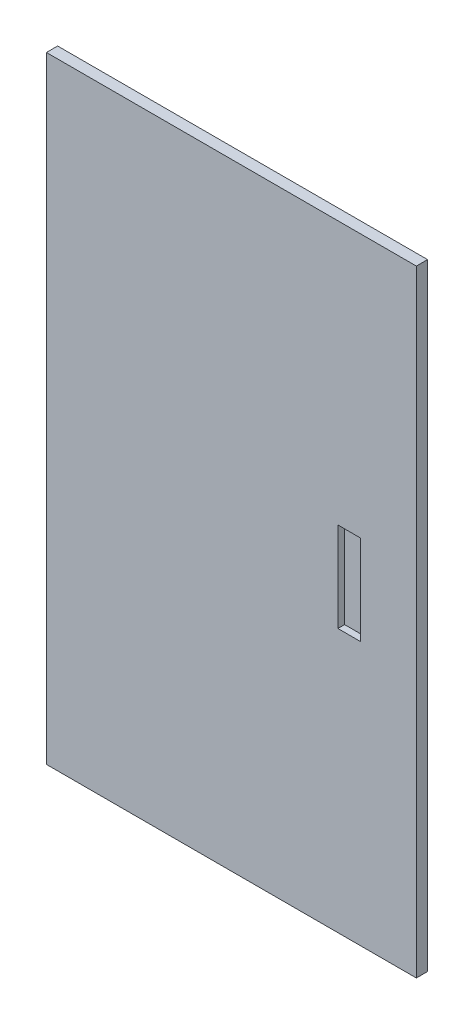
from build123d import *

# Parameters (mm, degrees)
SKETCH1_W           = 419.1
SKETCH1_H           = 698.5
BOSS_EXTRUDE1_DEPTH = 12.7
SKETCH2_W           = 38.1
SKETCH2_H           = 101.6
CUT_EXTRUDE1_DEPTH  = 7.62
SKETCH3_W           = 12.7
SKETCH3_H           = 101.6
BOSS_EXTRUDE2_DEPTH = 2.54
FILLET1_R           = 2.54


with BuildPart() as part:
    # Sketch1 → Boss-Extrude1 (new body)
    with BuildSketch(Plane.XY):
        Rectangle(SKETCH1_W, SKETCH1_H)
    extrude(amount=BOSS_EXTRUDE1_DEPTH)

    # Sketch2 → Cut-Extrude1 (cut)
    with BuildSketch(Plane.XY.offset(12.7)):
        with Locations((139.7, 0)):
            Rectangle(SKETCH2_W, SKETCH2_H)
    extrude(amount=-CUT_EXTRUDE1_DEPTH, mode=Mode.SUBTRACT)

    # Sketch3 → Boss-Extrude2 (add)
    with BuildSketch(Plane.XY.offset(12.7)):
        with Locations((152.4, 0)):
            Rectangle(SKETCH3_W, SKETCH3_H)
    extrude(amount=-BOSS_EXTRUDE2_DEPTH)

    # Fillet1
    fillet1_edges = [part.edges().sort_by_distance(p)[0] for p in [
        (146.05, 0, 10.16),
    ]]
    fillet(fillet1_edges, radius=FILLET1_R - 0.0001)  # a hair under: the kernel refuses the full size


solid = part.part
